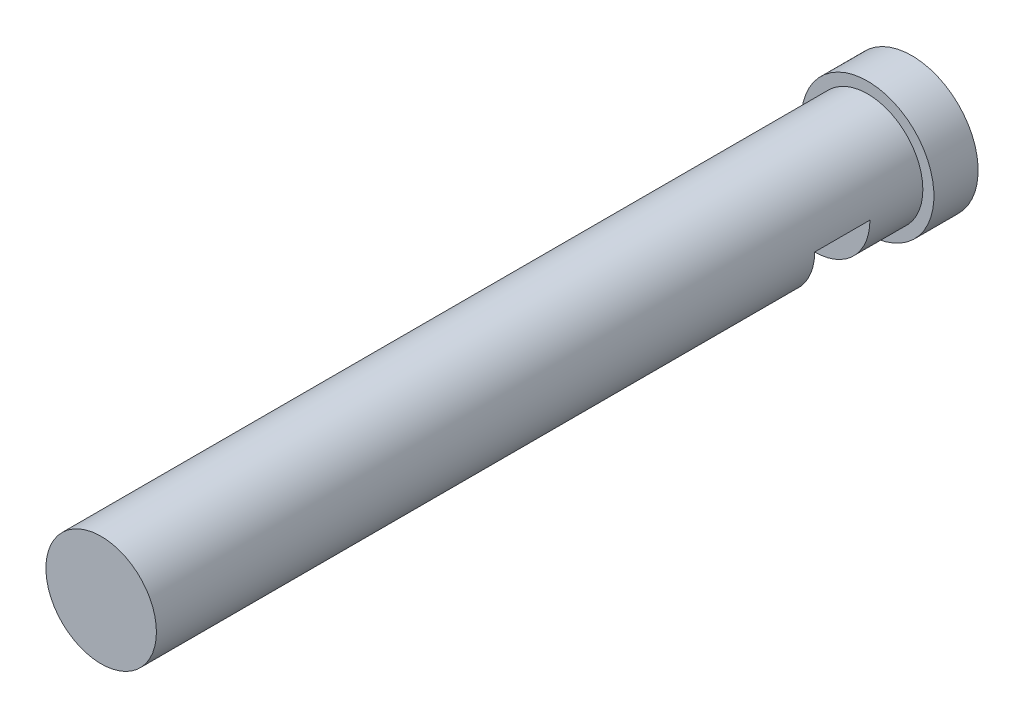
from build123d import *

# Parameters (mm, degrees)
SKETCH1_R           = 6.35
BOSS_EXTRUDE1_DEPTH = 6.0833
SKETCH4_R           = 7.62
BOSS_EXTRUDE2_DEPTH = 5.08
BOSS_EXTRUDE3_DEPTH = 6.35
SKETCH13_R          = 6.35
BOSS_EXTRUDE4_DEPTH = 75.63612


with BuildPart() as part:
    # Sketch1 → Boss-Extrude1 (new body)
    with BuildSketch(Plane.XY):
        Circle(SKETCH1_R)
    extrude(amount=BOSS_EXTRUDE1_DEPTH)

    # Sketch4 → Boss-Extrude2 (add)
    with BuildSketch(Plane(origin=(0, 0, 0), x_dir=(-1, 0, 0), z_dir=(0, 0, -1))):
        Circle(SKETCH4_R)
    extrude(amount=BOSS_EXTRUDE2_DEPTH)

    # Sketch12 → Boss-Extrude3 (add)
    with BuildSketch(Plane.XY.offset(6.0833)):
        with BuildLine():
            Line((0, -6.35), (6.35, 0))
            ThreePointArc((6.35, 0), (-4.490128061, 4.490128061), (0, -6.35))
        make_face()
    extrude(amount=BOSS_EXTRUDE3_DEPTH)

    # Sketch13 → Boss-Extrude4 (add)
    with BuildSketch(Plane.XY.offset(12.4333)):
        Circle(SKETCH13_R)
    extrude(amount=BOSS_EXTRUDE4_DEPTH)


solid = part.part
